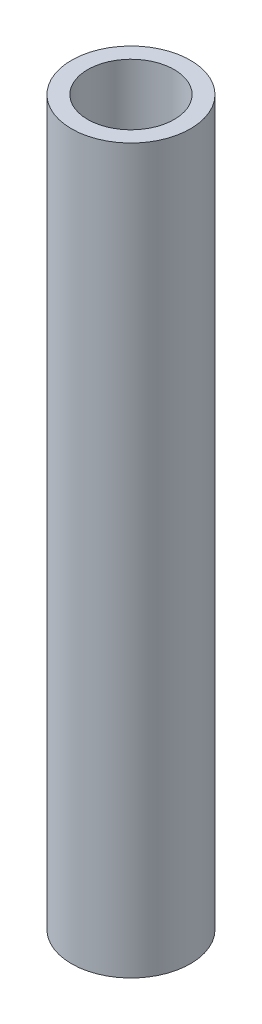
from build123d import *

# Parameters (mm, degrees)
SKETCH1_R           = 16.7005
SKETCH1_R_2         = 12.1539
BOSS_EXTRUDE1_DEPTH = 101.6


with BuildPart() as part:
    # Sketch1 → Boss-Extrude1 (new, symmetric)
    with BuildSketch(Plane(origin=(0, 0, 0), x_dir=(1, 0, 0), z_dir=(0, 1, 0))):
        Circle(SKETCH1_R)
        Circle(SKETCH1_R_2, mode=Mode.SUBTRACT)
    extrude(amount=BOSS_EXTRUDE1_DEPTH, both=True)


solid = part.part
